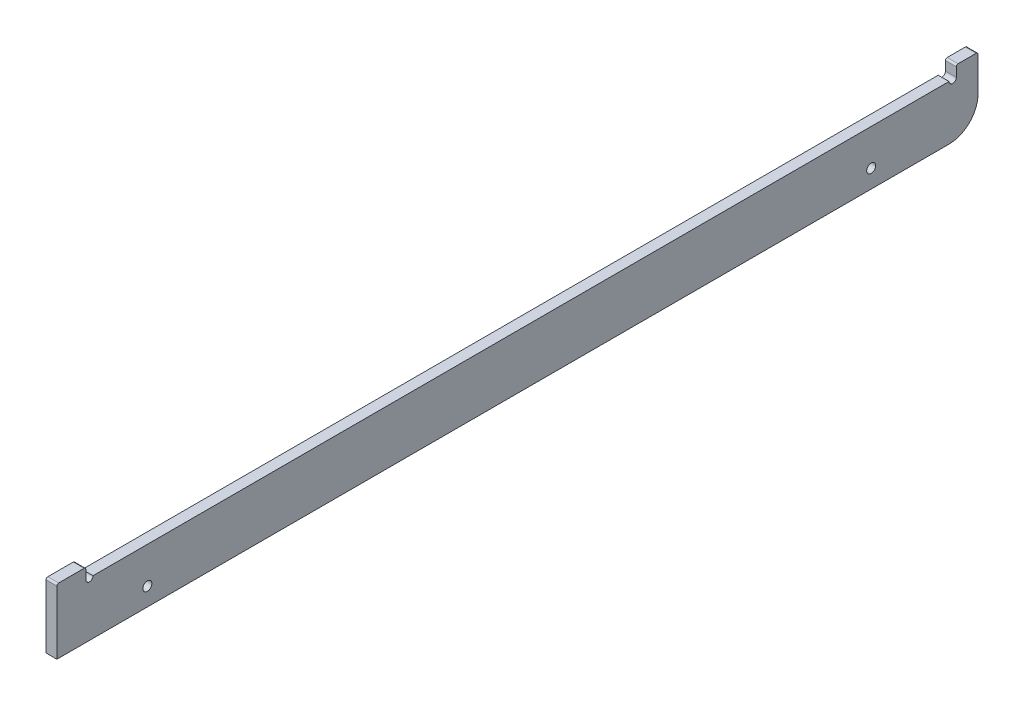
from build123d import *

# Parameters (mm, degrees)
SKETCH_1_W          = 254.5
SKETCH_1_H          = 15
EXTRUDE_1_DEPTH     = 3
SKETCH_2_W          = 8
SKETCH_2_H          = 3
SKETCH_2_W_2        = 6
EXTRUDE_2_DEPTH     = 3
SKETCH_3_R          = 1
CUT_EXTRUDE_1_DEPTH = 3
FILLET_1_R          = 0.5
SKETCH_4_R          = 1.25
CUT_EXTRUDE_2_DEPTH = 10
FILLET_2_R          = 8


with BuildPart() as part:
    # 스케치1 → 보스-돌출1 (new body)
    with BuildSketch(Plane(origin=(0, 0, 0), x_dir=(0, 0, -1), z_dir=(1, 0, 0))):
        with Locations((127.25, 7.5)):
            Rectangle(SKETCH_1_W, SKETCH_1_H)
    extrude(amount=EXTRUDE_1_DEPTH)

    # 스케치2 → 보스-돌출2 (add)
    with BuildSketch(Plane(origin=(3, 0, 0), x_dir=(0, 0, -1), z_dir=(1, 0, 0))):
        with Locations((4, 16.5)):
            Rectangle(SKETCH_2_W, SKETCH_2_H)
        with Locations((251.5, 16.5)):
            Rectangle(SKETCH_2_W_2, SKETCH_2_H)
    extrude(amount=-EXTRUDE_2_DEPTH)

    # 스케치3 → 컷-돌출1 (cut)
    with BuildSketch(Plane(origin=(3, 0, 0), x_dir=(0, 0, -1), z_dir=(1, 0, 0))):
        with Locations((9, 15)):
            Circle(SKETCH_3_R)
        with Locations((247.5, 15)):
            Circle(SKETCH_3_R)
    extrude(amount=-CUT_EXTRUDE_1_DEPTH, mode=Mode.SUBTRACT)

    # 필렛1
    fillet_1_edges = [part.edges().sort_by_distance(p)[0] for p in [
        (1.5, 18, -254.5),
        (1.5, 18, -248.5),
        (1.5, 18, -8),
        (1.5, 18, 0),
    ]]
    fillet(fillet_1_edges, radius=FILLET_1_R)

    # 스케치4 → 컷-돌출2 (cut)
    with BuildSketch(Plane(origin=(3, 0, 0), x_dir=(0, 0, -1), z_dir=(1, 0, 0))):
        with Locations((225, 5)):
            Circle(SKETCH_4_R)
        with Locations((25, 5)):
            Circle(SKETCH_4_R)
    extrude(amount=-CUT_EXTRUDE_2_DEPTH, mode=Mode.SUBTRACT)

    # 필렛2
    fillet_2_edges = [part.edges().sort_by_distance(p)[0] for p in [
        (1.5, 0, -254.5),
    ]]
    fillet(fillet_2_edges, radius=FILLET_2_R)


solid = part.part
